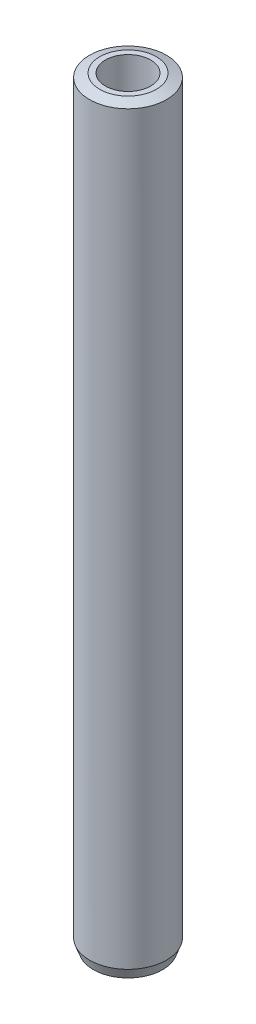
from build123d import *
from OCP.BRepFilletAPI import BRepFilletAPI_MakeChamfer

# Parameters (mm, degrees)
SKETCH1_R           = 22.5
BOSS_EXTRUDE1_DEPTH = 443.759268873
SKETCH2_R           = 13.231012936
CUT_EXTRUDE1_DEPTH  = 445.898627454
CHAMFER1_SIZE       = 2.219797112
CHAMFER1_SIZE2      = 5.961559153


with BuildPart() as part:
    # Sketch1 → Boss-Extrude1 (new body)
    with BuildSketch(Plane(origin=(0, 0, 0), x_dir=(1, 0, 0), z_dir=(0, 1, 0))):
        Circle(SKETCH1_R)
    extrude(amount=BOSS_EXTRUDE1_DEPTH)

    # Sketch2 → Cut-Extrude1 (cut, through all)
    with BuildSketch(Plane(origin=(0, 0, 0), x_dir=(1, 0, 0), z_dir=(0, 1, 0))):
        Circle(SKETCH2_R)
    extrude(amount=CUT_EXTRUDE1_DEPTH, mode=Mode.SUBTRACT)

    # Chamfer1: one chamfer whose edges measure the first distance from different faces: ONE call of the kernel's chamfer builder (chamfer() names one face for all edges)
    chamfer1_edges_1 = [part.edges().sort_by_distance(p)[0] for p in [
        (-22.5, 443.759268873, 0),
    ]]
    chamfer1_side_1 = [part.faces().sort_by_distance(p)[0] for p in [
        (-22.5, 221.879634436, 0),
    ]]
    chamfer1_edges_2 = [part.edges().sort_by_distance(p)[0] for p in [
        (-22.5, 0, 0),
    ]]
    chamfer1_side_2 = [part.faces().sort_by_distance(p)[0] for p in [
        (-21.863603897, 0, 0),
    ]]
    chamfer1 = BRepFilletAPI_MakeChamfer(part.part.solid().wrapped)
    for e in chamfer1_edges_1:
        chamfer1.Add(CHAMFER1_SIZE, CHAMFER1_SIZE2, e.wrapped, chamfer1_side_1[0].wrapped)  # the first distance lies on this face
    for e in chamfer1_edges_2:
        chamfer1.Add(CHAMFER1_SIZE, CHAMFER1_SIZE2, e.wrapped, chamfer1_side_2[0].wrapped)  # the first distance lies on this face
    add(Compound.cast(chamfer1.Shape()), mode=Mode.REPLACE)


solid = part.part
